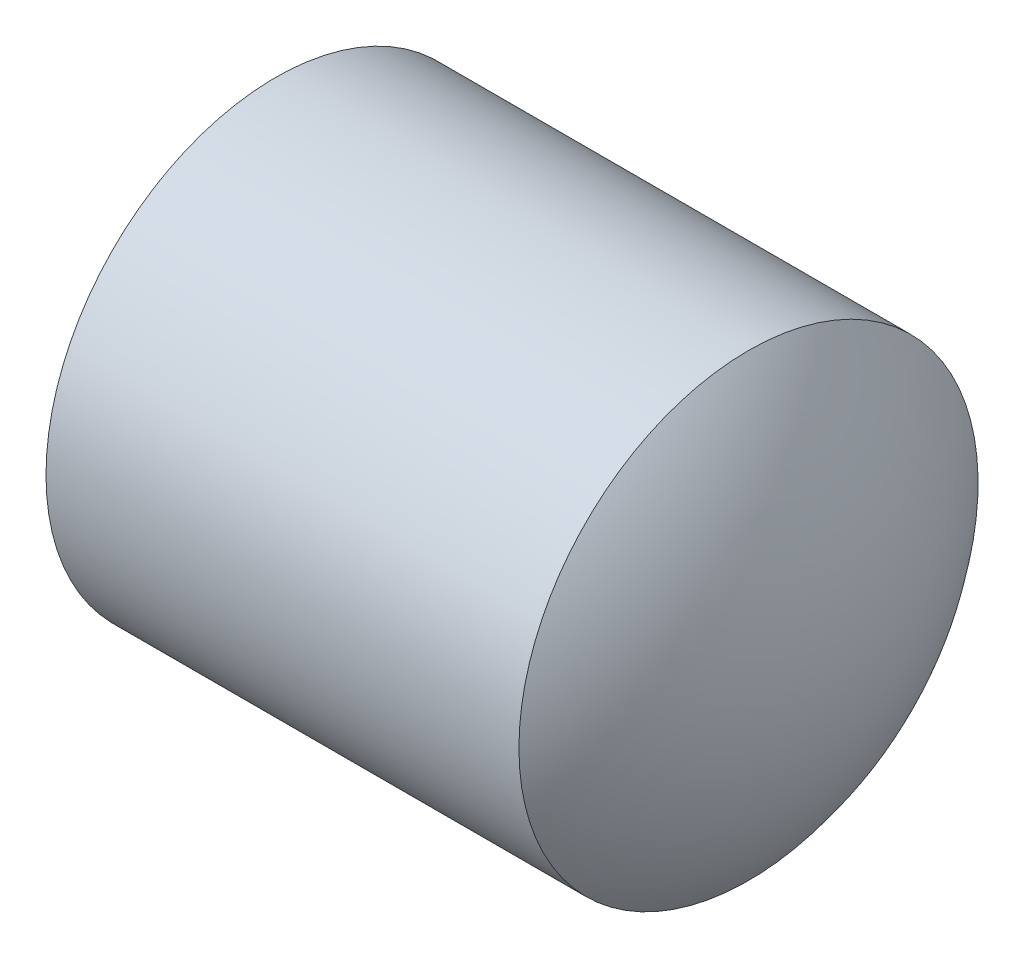
from build123d import *

# Parameters (mm, degrees)
HEX_2_DEPTH = 12


with BuildPart() as part:
    # BodySke → BaseBody (revolve)
    with BuildSketch(Plane.XY):
        with BuildLine():
            Line((0, 0), (0, 10.352))
            Line((0, 10.352), (0.951473244, 12))
            Line((0.951473244, 12), (25.672042012, 12))
            ThreePointArc((25.672042012, 12), (28.884942604, 6.378307384), (30, 0))
            Line((30, 0), (0, 0))
        make_face()
    revolve(axis=Axis((-12.7, 0, 0), (1, 0, 0)))

    # Sketch2 → Hex 2 (cut)
    with BuildSketch(Plane.ZY):
        Polygon((3.464101615, 6), (-3.464101615, 6), (-6.92820323, 0), (-3.464101615, -6), (3.464101615, -6), (6.92820323, 0), align=None)
    extrude(amount=-HEX_2_DEPTH, mode=Mode.SUBTRACT)


solid = part.part
